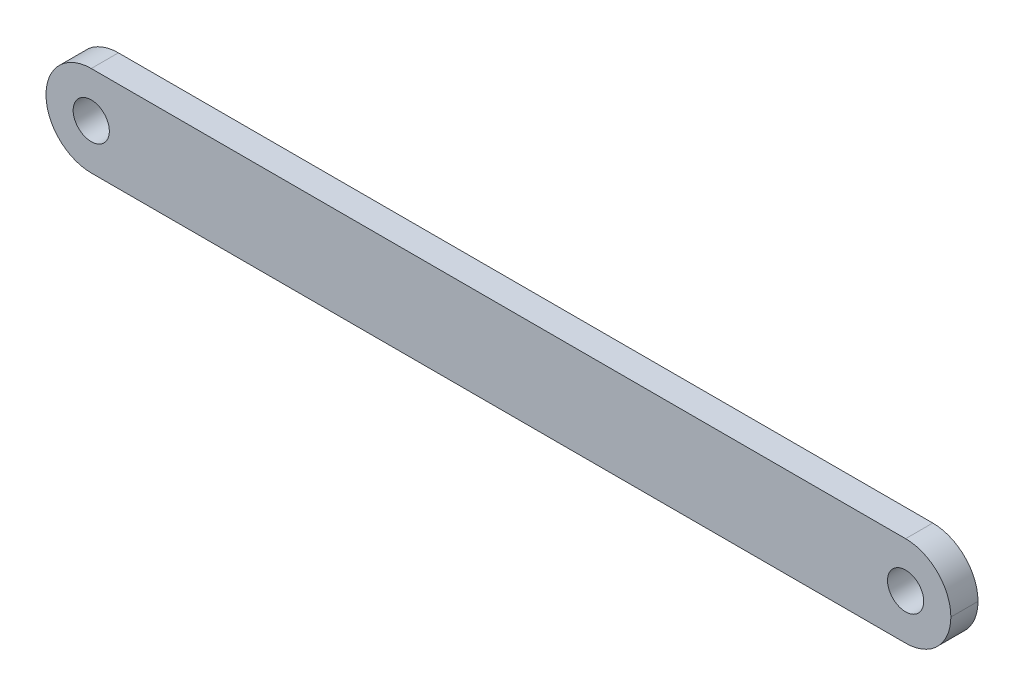
from build123d import *

# Parameters (mm, degrees)
SKETCH_1_W      = 100
SKETCH_1_H      = 10
SKETCH_1_R      = 2
EXTRUDE_1_DEPTH = 3
FILLET_1_R      = 5


with BuildPart() as part:
    # 草图1 → 凸台-拉伸1 (new body)
    with BuildSketch(Plane.XY):
        Rectangle(SKETCH_1_W, SKETCH_1_H)
        with Locations((-45, 0)):
            Circle(SKETCH_1_R, mode=Mode.SUBTRACT)
        with Locations((45, 0)):
            Circle(SKETCH_1_R, mode=Mode.SUBTRACT)
    extrude(amount=EXTRUDE_1_DEPTH)

    # 圆角1
    fillet_1_edges = [part.edges().sort_by_distance(p)[0] for p in [
        (50, -5, 1.5),
        (50, 5, 1.5),
        (-50, -5, 1.5),
        (-50, 5, 1.5),
    ]]
    fillet(fillet_1_edges, radius=FILLET_1_R - 0.0001)  # a hair under: the kernel refuses the full size


solid = part.part
